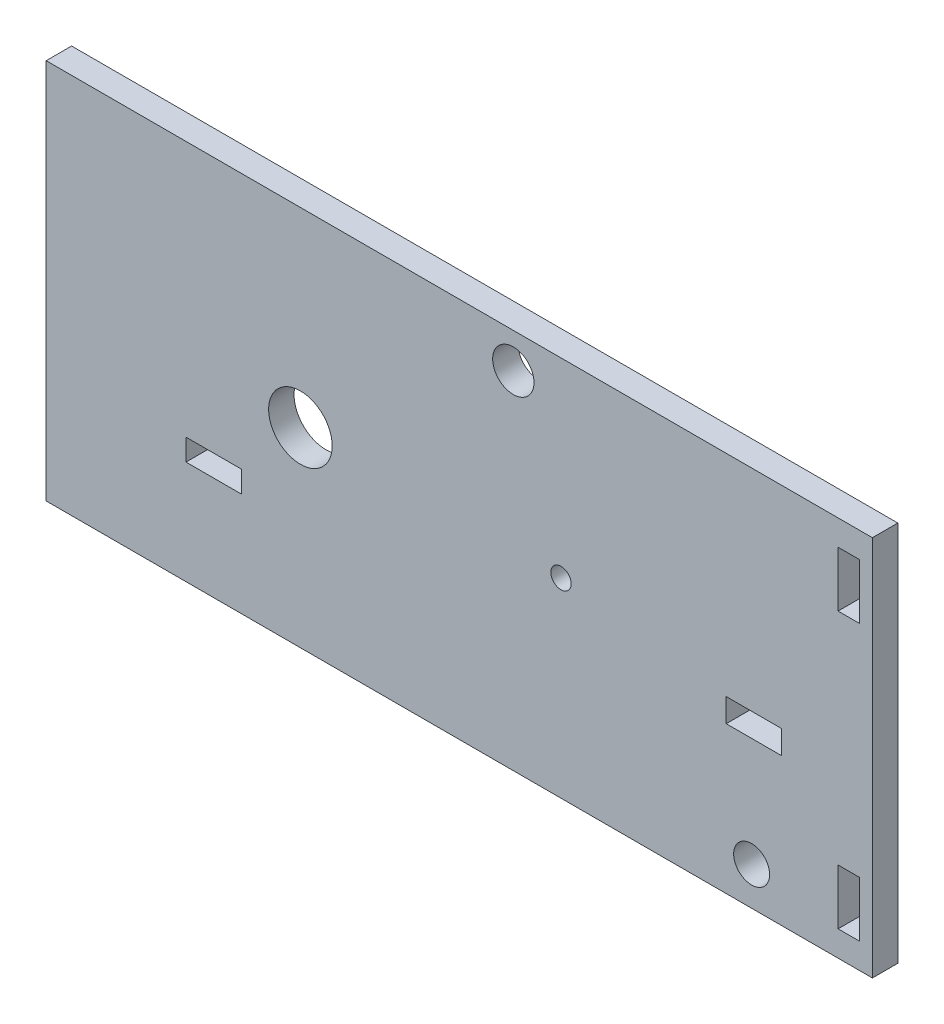
from build123d import *

# Parameters (mm, degrees)
SKETCH1_W           = 130
SKETCH1_H           = 60
SKETCH1_R           = 5
SKETCH1_R_2         = 3.25
SKETCH1_R_3         = 2.83
SKETCH1_R_4         = 1.6
SKETCH1_W_2         = 8.7
SKETCH1_H_2         = 3.4
SKETCH1_W_3         = 3.4
SKETCH1_H_3         = 8.7
SKETCH1_H_4         = 3.7
BOSS_EXTRUDE1_DEPTH = 2


with BuildPart() as part:
    # Sketch1 → Boss-Extrude1 (new, symmetric)
    with BuildSketch(Plane.XY):
        with Locations((-21, 0)):
            Rectangle(SKETCH1_W, SKETCH1_H)
        with Locations((-46, 0)):
            Circle(SKETCH1_R, mode=Mode.SUBTRACT)
        with Locations((-12.5, 24.5)):
            Circle(SKETCH1_R_2, mode=Mode.SUBTRACT)
        with Locations((25, -24)):
            Circle(SKETCH1_R_3, mode=Mode.SUBTRACT)
        with Locations((-5, 0)):
            Circle(SKETCH1_R_4, mode=Mode.SUBTRACT)
        with Locations((-59.65, -12)):
            Rectangle(SKETCH1_W_2, SKETCH1_H_2, mode=Mode.SUBTRACT)
        with Locations((40.3, 21.65)):
            Rectangle(SKETCH1_W_3, SKETCH1_H_3, mode=Mode.SUBTRACT)
        with Locations((40.3, -21.65)):
            Rectangle(SKETCH1_W_3, SKETCH1_H_3, mode=Mode.SUBTRACT)
        with Locations((25.35, -5)):
            Rectangle(SKETCH1_W_2, SKETCH1_H_4, mode=Mode.SUBTRACT)
    extrude(amount=BOSS_EXTRUDE1_DEPTH, both=True)


solid = part.part
